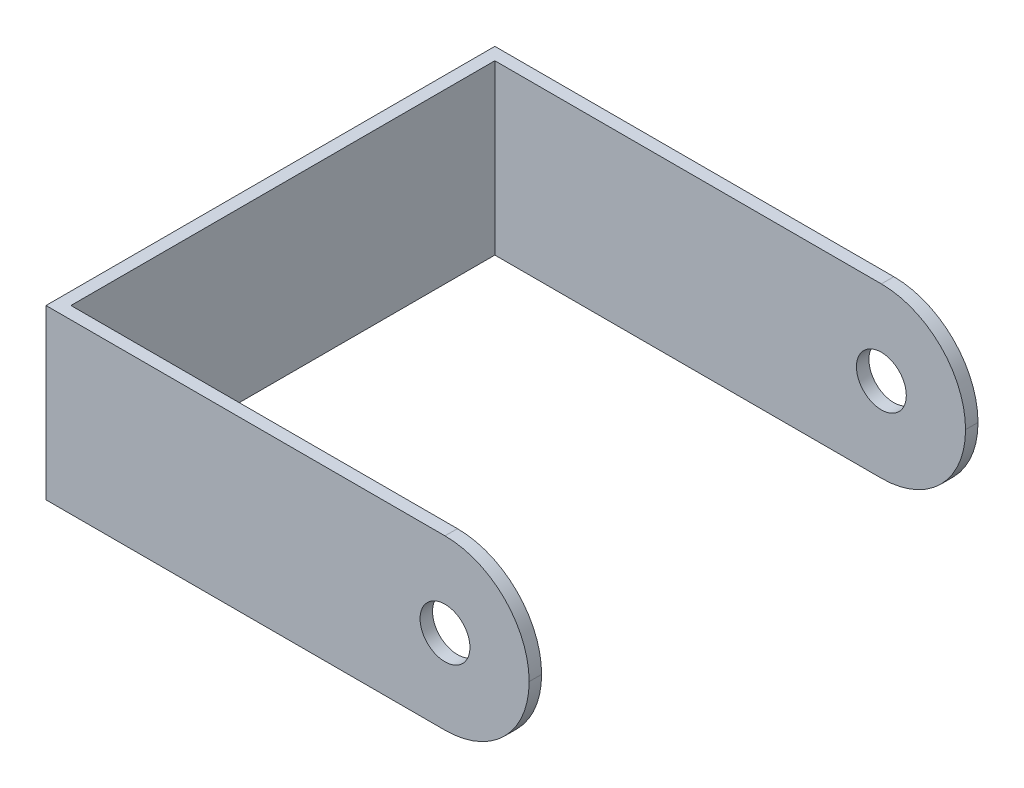
from build123d import *

# Parameters (mm, degrees)
SKETCH1_W           = 77.5
SKETCH1_H           = 72
BOSS_EXTRUDE2_DEPTH = 27
SKETCH2_W           = 73.5
SKETCH2_H           = 68
CUT_EXTRUDE1_DEPTH  = 27
SKETCH7_W           = 2
SKETCH7_H           = 68
CUT_EXTRUDE2_DEPTH  = 27
FILLET6_R           = 13.5
FILLET7_R           = 13.5
SKETCH9_R           = 4
CUT_EXTRUDE3_DEPTH  = 94


with BuildPart() as part:
    # Sketch1 → Boss-Extrude2 (new body)
    with BuildSketch(Plane(origin=(0, 0, 0), x_dir=(1, 0, 0), z_dir=(0, 1, 0))):
        with Locations((-311.893899893, -425.385906876)):
            Rectangle(SKETCH1_W, SKETCH1_H)
    extrude(amount=BOSS_EXTRUDE2_DEPTH)

    # Sketch2 → Cut-Extrude1 (cut)
    with BuildSketch(Plane(origin=(0, 27, 0), x_dir=(1, 0, 0), z_dir=(0, 1, 0))):
        with Locations((-311.893899893, -425.385906876)):
            Rectangle(SKETCH2_W, SKETCH2_H)
    extrude(amount=-CUT_EXTRUDE1_DEPTH, mode=Mode.SUBTRACT)

    # Sketch7 → Cut-Extrude2 (cut)
    with BuildSketch(Plane(origin=(0, 27, 0), x_dir=(1, 0, 0), z_dir=(0, 1, 0))):
        with Locations((-274.143899893, -425.385906876)):
            Rectangle(SKETCH7_W, SKETCH7_H)
    extrude(amount=-CUT_EXTRUDE2_DEPTH, mode=Mode.SUBTRACT)

    # Fillet6
    fillet6_edges = [part.edges().sort_by_distance(p)[0] for p in [
        (-273.143899893, 0, 460.385906876),
        (-273.143899893, 27, 460.385906876),
    ]]
    fillet(fillet6_edges, radius=FILLET6_R - 0.0001)  # a hair under: the kernel refuses the full size

    # Fillet7
    fillet7_edges = [part.edges().sort_by_distance(p)[0] for p in [
        (-273.143899893, 0, 390.385906876),
        (-273.143899893, 27, 390.385906876),
    ]]
    fillet(fillet7_edges, radius=FILLET7_R - 0.0001)  # a hair under: the kernel refuses the full size

    # Sketch9 → Cut-Extrude3 (cut)
    with BuildSketch(Plane.XY.offset(461.385906876)):
        with Locations((-286.643899893, 13.5)):
            Circle(SKETCH9_R)
    extrude(amount=-CUT_EXTRUDE3_DEPTH, mode=Mode.SUBTRACT)


solid = part.part
